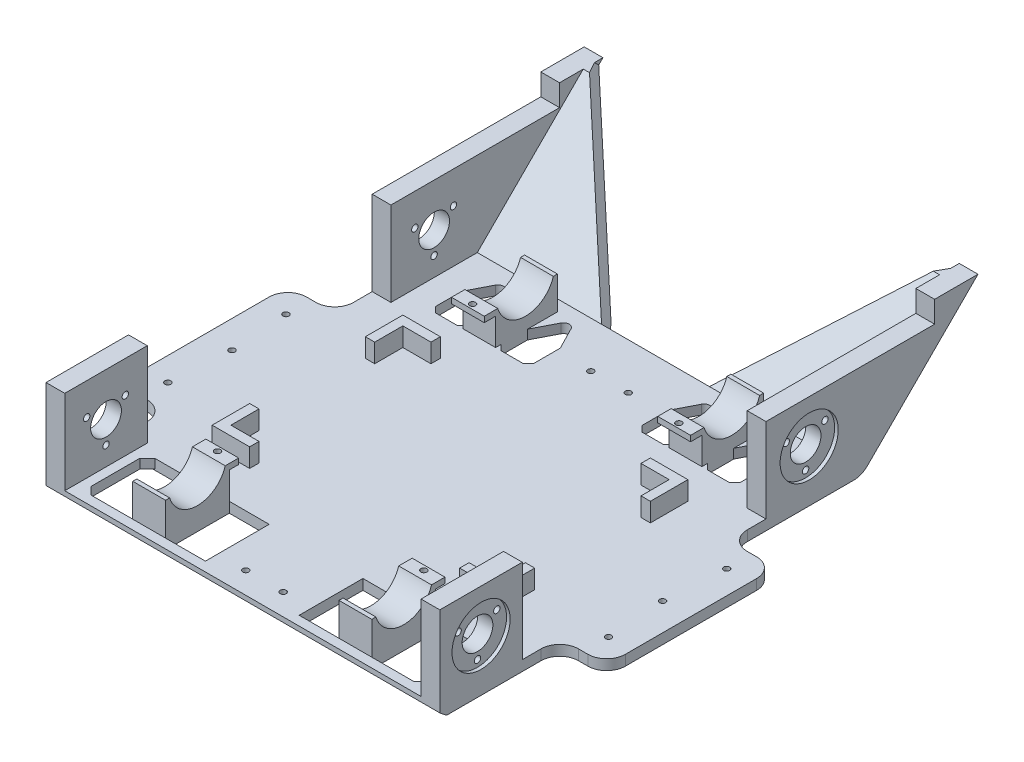
from build123d import *
from build123d.topology import SkipClean

# Parameters (mm, degrees)
SKETCH_1_W               = 5
SKETCH_1_H               = 10
EXTRUDE_1_DEPTH          = 5.5
SKETCH_3_W               = 5
SKETCH_3_H               = 46.066203836
SKETCH_3_H_2             = 44
EXTRUDE_2_DEPTH          = 44
CUT_EXTRUDE_1_DEPTH      = 316.357337
CUT_EXTRUDE_1_DEPTH_BACK = 316.357337
SKETCH_4_R               = 8.2
SKETCH_4_R_2             = 1.7
SKETCH_5_R               = 15.5
CUT_EXTRUDE_3_DEPTH      = 1.9
CUT_EXTRUDE_START        = -1.9
SKETCH_6_R               = 15.5
CUT_EXTRUDE_4_DEPTH      = 1.9
CUT_EXTRUDE_5_DEPTH      = 316.357337
CUT_EXTRUDE_5_DEPTH_BACK = 316.357337
SKETCH_7_R               = 8.2
SKETCH_7_R_2             = 1.7
SKETCH_8_R               = 15.5
CUT_EXTRUDE_6_DEPTH      = 1.9
SKETCH_9_R               = 15.5
CUT_EXTRUDE_7_DEPTH      = 1.9
SKETCH_10_W              = 10
SKETCH_10_H              = 34
EXTRUDE_3_DEPTH          = 5
SKETCH_11_W              = 5
SKETCH_11_H              = 41.066203836
SKETCH_11_H_2            = 5
SKETCH_11_H_3            = 44
EXTRUDE_4_DEPTH          = 44
CUT_EXTRUDE_8_DEPTH      = 315.095304008
CUT_EXTRUDE_8_DEPTH_BACK = 315.095304008
SKETCH_12_R              = 1.7
SKETCH_12_R_2            = 8.2
SKETCH_17_W              = 210
SKETCH_17_H              = 49.493882771
EXTRUDE_5_DEPTH          = 7.424621
EXTRUDE_11_DEPTH         = 5
EXTRUDE_13_DEPTH         = 210
FILLET_1_R               = 10
EXTRUDE_14_DEPTH         = 5
SKETCH_26_W              = 25
SKETCH_26_H              = 90
EXTRUDE_15_DEPTH         = 5.5
FILLET_2_R               = 10
CHAMFER_1_SIZE           = 4
CHAMFER_2_SIZE           = 3
FILLET_3_R               = 3
EXTRUDE_16_DEPTH         = 10
SKETCH_36_R              = 1.6
CUT_EXTRUDE_11_DEPTH     = 332.754427403
EXTRUDE_START            = -10
EXTRUDE_17_DEPTH         = 10
EXTRUDE_18_DEPTH         = 10
SKETCH_20_W              = 40
SKETCH_20_H              = 48.239190952
CUT_EXTRUDE_12_DEPTH     = 329.1701161
EXTRUDE_19_DEPTH         = 10
EXTRUDE_20_DEPTH         = 10
EXTRUDE_22_DEPTH         = 7.424621
CUT_EXTRUDE_13_DEPTH     = 190
EXTRUDE_23_DEPTH         = 210
CUT_EXTRUDE_14_DEPTH     = 331.617036792
SKETCH_45_W              = 190
SKETCH_45_H              = 7.424621202
CUT_EXTRUDE_16_DEPTH     = 27
EXTRUDE_25_DEPTH         = 5.5
CUT_EXTRUDE_START_2      = -210
CUT_EXTRUDE_20_DEPTH     = 210
FILLET_START             = -1
FILLET_4_DEPTH           = 212
SKETCH_54_W              = 17.5
SKETCH_54_H              = 34
EXTRUDE_26_DEPTH         = 17.5
SKETCH_55_W              = 17.5
SKETCH_55_H              = 34
EXTRUDE_27_DEPTH         = 5.5
CUT_EXTRUDE_START_3      = -17.5
SKETCH_56_R              = 15.5
CUT_EXTRUDE_22_DEPTH     = 127.5
SKETCH_57_W              = 5
SKETCH_57_H              = 3
EXTRUDE_28_DEPTH         = 17.5
EXTRUDE_START_2          = -17.5
SKETCH_60_W              = 5
SKETCH_60_H              = 3
EXTRUDE_29_DEPTH         = 17.5
SKETCH_62_R              = 1.6
CUT_EXTRUDE_24_DEPTH     = 3
EXTRUDE_30_DEPTH         = 17.5
EXTRUDE_31_DEPTH         = 17.5
SKETCH_66_W              = 1.033101918
SKETCH_66_H              = 3
EXTRUDE_32_DEPTH         = 17.5
EXTRUDE_33_DEPTH         = 17.5
SKETCH_68_R              = 1.6
CUT_EXTRUDE_25_DEPTH     = 3
SKETCH_69_R              = 1.6
CUT_EXTRUDE_26_DEPTH     = 333.513953992
SKETCH_70_W              = 43
SKETCH_70_H              = 15.5
CUT_EXTRUDE_27_DEPTH     = 210
CUT_EXTRUDE_28_DEPTH     = 210
SKETCH_74_W              = 210
SKETCH_74_H              = 2.596747752
CUT_EXTRUDE_30_DEPTH     = 10
SKETCH_75_W              = 10
SKETCH_75_H              = 44
SKETCH_75_H_2            = 89.924068212
EXTRUDE_34_DEPTH         = 1


with BuildPart() as part:
    # 草图1 → 凸台-拉伸1 (new body)
    with BuildSketch(Plane(origin=(0, 0, 0), x_dir=(1, 0, 0), z_dir=(0, 1, 0))):
        Polygon((85, -44), (5, -44), (5, -186), (85, -186), (85, -220), (125, -220), (125, -186), (205, -186), (205, -44), (125, -44), (125, -10), (85, -10), align=None)
        Polygon((3, 0), (0, 0), (0, -10), (5, -10), (5, 0), align=None)
        Polygon((5, -10), (0, -10), (0, -220), (5, -220), (5, -186), (5, -44), align=None)
        Polygon((205, 0), (5, 0), (5, -10), (85, -10), (125, -10), (205, -10), align=None)
        Polygon((210, -10), (205, -10), (205, -44), (205, -186), (205, -220), (210, -220), align=None)
        with Locations((207.5, -5)):
            Rectangle(SKETCH_1_W, SKETCH_1_H)
        Polygon((85, -220), (5, -220), (5, -230), (205, -230), (205, -220), (125, -220), align=None)
        with Locations((2.5, -225)):
            Rectangle(SKETCH_1_W, SKETCH_1_H)
        with Locations((207.5, -225)):
            Rectangle(SKETCH_1_W, SKETCH_1_H)
    extrude(amount=EXTRUDE_1_DEPTH)

    # 草图3 → 凸台-拉伸2 (add)
    with BuildSketch(Plane(origin=(0, 5.5, 0), x_dir=(1, 0, 0), z_dir=(0, 1, 0))):
        with Locations((2.5, -28.033101918)):
            Rectangle(SKETCH_3_W, SKETCH_3_H)
        with Locations((2.5, -203)):
            Rectangle(SKETCH_3_W, SKETCH_3_H_2)
        with Locations((207.5, -203)):
            Rectangle(SKETCH_3_W, SKETCH_3_H_2)
        with Locations((207.5, -28.033101918)):
            Rectangle(SKETCH_3_W, SKETCH_3_H)
    extrude(amount=EXTRUDE_2_DEPTH)

    # 草图4 → 切除-拉伸1 (cut, two sides: drawn at the far end of the back side and taken through both)
    with BuildSketch(Plane.ZY.offset(-CUT_EXTRUDE_1_DEPTH_BACK)):
        with Locations((28.033101918, 27.5)):
            Circle(SKETCH_4_R)
        with Locations((28.033101918, 15.6)):
            Circle(SKETCH_4_R_2)
        with Locations((17.727399613, 33.45)):
            Circle(SKETCH_4_R_2)
        with Locations((38.338804223, 33.45)):
            Circle(SKETCH_4_R_2)
    extrude(amount=CUT_EXTRUDE_1_DEPTH + CUT_EXTRUDE_1_DEPTH_BACK, mode=Mode.SUBTRACT)

    # 草图5 → 切除-拉伸3 (cut)
    with BuildSketch(Plane.ZY):
        with Locations((28.033101918, 27.5)):
            Circle(SKETCH_5_R)
    extrude(amount=-CUT_EXTRUDE_3_DEPTH, mode=Mode.SUBTRACT)

    # 草图6 → 切除-拉伸4 (cut)
    with BuildSketch(Plane(origin=(210, 0, 0), x_dir=(0, 0, -1), z_dir=(1, 0, 0)).offset(CUT_EXTRUDE_START)):
        with Locations(Location((-28.033101918, 27.5, 0), (0, 0, 180))):
            Circle(SKETCH_6_R)
    extrude(amount=CUT_EXTRUDE_4_DEPTH, mode=Mode.SUBTRACT)

    # 草图7 → 切除-拉伸5 (cut, two sides: drawn at the far end of the back side and taken through both)
    with BuildSketch(Plane.ZY.offset(-CUT_EXTRUDE_5_DEPTH_BACK)):
        with Locations((203, 27.5)):
            Circle(SKETCH_7_R)
        with Locations((203, 15.6)):
            Circle(SKETCH_7_R_2)
        with Locations((192.694297695, 33.45)):
            Circle(SKETCH_7_R_2)
        with Locations((213.305702305, 33.45)):
            Circle(SKETCH_7_R_2)
    extrude(amount=CUT_EXTRUDE_5_DEPTH + CUT_EXTRUDE_5_DEPTH_BACK, mode=Mode.SUBTRACT)

    # 草图8 → 切除-拉伸6 (cut)
    with BuildSketch(Plane.ZY):
        with Locations((203, 27.5)):
            Circle(SKETCH_8_R)
    extrude(amount=-CUT_EXTRUDE_6_DEPTH, mode=Mode.SUBTRACT)

    # 草图9 → 切除-拉伸7 (cut)
    with BuildSketch(Plane(origin=(210, 0, 0), x_dir=(0, 0, -1), z_dir=(1, 0, 0)).offset(CUT_EXTRUDE_START)):
        with Locations(Location((-203, 27.5, 0), (0, 0, 180))):
            Circle(SKETCH_9_R)
    extrude(amount=CUT_EXTRUDE_7_DEPTH, mode=Mode.SUBTRACT)

    # 草图10 → 凸台-拉伸3 (add)
    with BuildSketch(Plane(origin=(0, 5.5, 0), x_dir=(1, 0, 0), z_dir=(0, 1, 0))):
        with Locations((200, -27)):
            Rectangle(SKETCH_10_W, SKETCH_10_H)
        with Locations((10, -27)):
            Rectangle(SKETCH_10_W, SKETCH_10_H)
        with Locations((10, -203)):
            Rectangle(SKETCH_10_W, SKETCH_10_H)
        with Locations((200, -203)):
            Rectangle(SKETCH_10_W, SKETCH_10_H)
    extrude(amount=-EXTRUDE_3_DEPTH)

    # 草图11 → 凸台-拉伸4 (add)
    with BuildSketch(Plane(origin=(0, 5.5, 0), x_dir=(1, 0, 0), z_dir=(0, 1, 0))):
        with Locations((7.5, -30.533101918)):
            Rectangle(SKETCH_11_W, SKETCH_11_H)
        with Locations((7.5, -7.5)):
            Rectangle(SKETCH_11_W, SKETCH_11_H_2)
        with Locations((202.5, -7.5)):
            Rectangle(SKETCH_11_W, SKETCH_11_H_2)
        with Locations((202.5, -30.533101918)):
            Rectangle(SKETCH_11_W, SKETCH_11_H)
        with Locations((7.5, -203)):
            Rectangle(SKETCH_11_W, SKETCH_11_H_3)
        with Locations((202.5, -203)):
            Rectangle(SKETCH_11_W, SKETCH_11_H_3)
    extrude(amount=EXTRUDE_4_DEPTH)

    # 草图12 → 切除-拉伸8 (cut, two sides: drawn at the far end of the back side and taken through both)
    with BuildSketch(Plane.ZY.offset(-1.9).offset(-CUT_EXTRUDE_8_DEPTH_BACK)):
        with Locations(Location((17.727399613, 33.45, 0), (0, 0, 180))):
            Circle(SKETCH_12_R)
        with Locations(Location((38.338804223, 33.45, 0), (0, 0, 180))):
            Circle(SKETCH_12_R)
        with Locations(Location((28.033101918, 15.6, 0), (0, 0, 180))):
            Circle(SKETCH_12_R)
        with Locations(Location((28.033101918, 27.5, 0), (0, 0, 180))):
            Circle(SKETCH_12_R_2)
        with Locations(Location((192.694297695, 33.45, 0), (0, 0, 180))):
            Circle(SKETCH_12_R)
        with Locations(Location((213.305702305, 33.45, 0), (0, 0, 180))):
            Circle(SKETCH_12_R)
        with Locations(Location((203, 15.6, 0), (0, 0, 180))):
            Circle(SKETCH_12_R)
        with Locations(Location((203, 27.5, 0), (0, 0, 180))):
            Circle(SKETCH_12_R_2)
    extrude(amount=CUT_EXTRUDE_8_DEPTH + CUT_EXTRUDE_8_DEPTH_BACK, mode=Mode.SUBTRACT)

    # 草图17 → 凸台-拉伸5 (add, through all)
    with BuildSketch(Plane(origin=(0, 5.25, 5.25), x_dir=(1, 0, 0), z_dir=(0, 0.7071067811865464, 0.7071067811865487))):
        with Locations((105, 25.100494776)):
            Rectangle(SKETCH_17_W, SKETCH_17_H)
    extrude(amount=-EXTRUDE_5_DEPTH)

    # 草图21 → 凸台-拉伸11 (add)
    with BuildSketch(Plane(origin=(0, 5.5, 0), x_dir=(1, 0, 0), z_dir=(0, 1, 0))):
        Polygon((15, -44), (32.5, -10), (15, -10), align=None)
        Polygon((67.5, -10), (32.5, -10), (41.25, -27), (50, -44), (58.75, -27), align=None)
        Polygon((50, -44), (41.25, -27), (41.25, -44), align=None)
        Polygon((58.75, -27), (50, -44), (58.75, -44), align=None)
        Polygon((85, -10), (67.5, -10), (85, -44), align=None)
        Polygon((125, -10), (125, -44), (142.5, -10), align=None)
        Polygon((177.5, -10), (142.5, -10), (151.25, -27), (160, -44), (168.75, -27), align=None)
        Polygon((195, -10), (177.5, -10), (195, -44), align=None)
        Polygon((168.75, -27), (160, -44), (168.75, -44), align=None)
        Polygon((151.25, -27), (151.25, -44), (160, -44), align=None)
    extrude(amount=-EXTRUDE_11_DEPTH)

    # 草图22 → 凸台-拉伸13 (add)
    with SkipClean():  # the faces are left unmerged after this step: merging them gives an invalid solid
        with BuildSketch(Plane.ZY):
            Polygon((0, 0.5), (0, 0), (-0.25, 0.25), align=None)
        extrude(amount=-EXTRUDE_13_DEPTH)

    # 圆角1
    fillet_1_edges = [part.edges().sort_by_distance(p)[0] for p in [
        (105, 0, 0),
    ]]
    fillet(fillet_1_edges, radius=FILLET_1_R)

    # 草图23 → 凸台-拉伸14 (add)
    with BuildSketch(Plane(origin=(0, 5.5, 0), x_dir=(1, 0, 0), z_dir=(0, 1, 0))):
        Polygon((23.75, -27), (23.75, -44), (15, -44), align=None)
        Polygon((76.25, -27), (76.25, -44), (85, -44), align=None)
        Polygon((133.75, -27), (133.75, -44), (125, -44), align=None)
        Polygon((186.25, -27), (186.25, -44), (195, -44), align=None)
    extrude(amount=-EXTRUDE_14_DEPTH)

    # 草图26 → 凸台-拉伸15 (add)
    with BuildSketch(Plane(origin=(0, 5.5, 0), x_dir=(1, 0, 0), z_dir=(0, 1, 0))):
        with Locations((-12.5, -116.033101918)):
            Rectangle(SKETCH_26_W, SKETCH_26_H)
        with Locations((222.5, -116.033101918)):
            Rectangle(SKETCH_26_W, SKETCH_26_H)
    extrude(amount=-EXTRUDE_15_DEPTH)

    # 圆角2
    fillet_2_edges = [part.edges().sort_by_distance(p)[0] for p in [
        (0, 2.75, 161.033101918),
        (-25, 2.75, 161.033101918),
        (-25, 2.75, 71.033101918),
        (0, 2.75, 71.033101918),
        (235, 2.75, 161.033101918),
        (210, 2.75, 161.033101918),
        (210, 2.75, 71.033101918),
        (235, 2.75, 71.033101918),
    ]]
    fillet(fillet_2_edges, radius=FILLET_2_R)

    # 倒角1
    chamfer_1_edges = [part.edges().sort_by_distance(p)[0] for p in [
        (15, 3, 186),
        (15, 3, 220),
        (195, 3, 220),
        (195, 3, 186),
        (85, 2.75, 220),
        (85, 2.75, 186),
        (125, 2.75, 186),
        (125, 2.75, 220),
    ]]
    chamfer(chamfer_1_edges, length=CHAMFER_1_SIZE)

    # 倒角2
    chamfer_2_edges = [part.edges().sort_by_distance(p)[0] for p in [
        (58.75, 3, 44),
        (41.25, 3, 44),
        (168.75, 3, 44),
        (151.25, 3, 44),
        (23.75, 3, 44),
        (76.25, 3, 44),
        (133.75, 3, 44),
        (186.25, 3, 44),
    ]]
    chamfer(chamfer_2_edges, length=CHAMFER_2_SIZE)

    # 圆角3
    fillet_3_edges = [part.edges().sort_by_distance(p)[0] for p in [
        (32.5, 3, 10),
        (67.5, 3, 10),
        (142.5, 3, 10),
        (177.5, 3, 10),
    ]]
    fillet(fillet_3_edges, radius=FILLET_3_R)

    # 草图28 → 凸台-拉伸16 (add)
    with BuildSketch(Plane(origin=(0, 5.5, 0), x_dir=(1, 0, 0), z_dir=(0, 1, 0))):
        Polygon((34, -83.707540062), (34, -68.707540058), (49, -68.707540058), (49, -63.707540062), (29, -63.707540062), (29, -83.707540062), align=None)
        Polygon((161, -63.707540062), (161, -68.707540058), (176, -68.707540058), (176, -83.707540062), (181, -83.707540062), (181, -63.707540062), align=None)
        Polygon((176, -160.407540058), (161, -160.407540058), (161, -165.407540062), (181, -165.407540062), (181, -145.407540062), (176, -145.407540062), align=None)
        Polygon((34, -160.407540058), (34, -145.407540062), (29, -145.407540062), (29, -165.407540062), (49, -165.407540062), (49, -160.407540058), align=None)
    extrude(amount=EXTRUDE_16_DEPTH)

    # 草图36 → 切除-拉伸11 (cut, through all)
    with BuildSketch(Plane(origin=(0, 5.5, 0), x_dir=(1, 0, 0), z_dir=(0, 1, 0))):
        with Locations(Location((115, -213.5, 0), (0, 0, 270))):
            Circle(SKETCH_36_R)
        with Locations(Location((222.5, -147.533101918, 0), (0, 0, 270))):
            Circle(SKETCH_36_R)
        with Locations(Location((222.5, -84.533101918, 0), (0, 0, 270))):
            Circle(SKETCH_36_R)
        with Locations(Location((115, -29.5, 0), (0, 0, 270))):
            Circle(SKETCH_36_R)
        with Locations(Location((95, -29.5, 0), (0, 0, 90))):
            Circle(SKETCH_36_R)
        with Locations(Location((-12.5, -84.533101918, 0), (0, 0, 90))):
            Circle(SKETCH_36_R)
        with Locations(Location((-12.5, -147.533101918, 0), (0, 0, 90))):
            Circle(SKETCH_36_R)
        with Locations(Location((95, -213.5, 0), (0, 0, 90))):
            Circle(SKETCH_36_R)
    extrude(amount=-CUT_EXTRUDE_11_DEPTH, mode=Mode.SUBTRACT)

    # 草图18 → 凸台-拉伸17 (add)
    with BuildSketch(Plane.ZY.offset(EXTRUDE_START)):
        Polygon((-35.247460135, 35.247460135), (-29.997460135, 40.497460135), (-39, 49.5), (-44.25, 44.25), align=None)
        Polygon((-29.997460135, 40.497460135), (5, 5.5), (5, 49.5), (-39, 49.5), align=None)
    extrude(amount=EXTRUDE_17_DEPTH)

    # 草图37 → 凸台-拉伸18 (add)
    with BuildSketch(Plane(origin=(210, 0, 0), x_dir=(0, 0, -1), z_dir=(1, 0, 0)).offset(EXTRUDE_START)):
        Polygon((-5, 49.5), (-5, 5.5), (29.997460135, 40.497460135), (35.247460135, 35.247460135), (44.25, 44.25), (39, 49.5), align=None)
    extrude(amount=EXTRUDE_18_DEPTH)

    # 草图20 → 切除-拉伸12 (cut, through all)
    with BuildSketch(Plane(origin=(0, 5.25, 5.25), x_dir=(1, 0, 0), z_dir=(0, 0.7071067811865465, 0.7071067811865487))):
        Polygon((85, 49.847436162), (15, 49.847436162), (85, 1.60824521), align=None)
        with Locations((105, 25.727840686)):
            Rectangle(SKETCH_20_W, SKETCH_20_H)
        Polygon((125, 49.847436162), (125, 1.60824521), (195, 49.847436162), align=None)
    extrude(amount=-CUT_EXTRUDE_12_DEPTH, mode=Mode.SUBTRACT)

    # 草图38 → 凸台-拉伸19 (add)
    with BuildSketch(Plane.ZY.offset(EXTRUDE_START)):
        Polygon((4.142135624, 65), (4.142135624, 49.5), (-39, 49.5), (-44.25, 44.25), (-65, 65), (-38.958410494, 65), align=None)
    extrude(amount=EXTRUDE_19_DEPTH)

    # 草图39 → 凸台-拉伸20 (add)
    with BuildSketch(Plane(origin=(210, 0, 0), x_dir=(0, 0, -1), z_dir=(1, 0, 0)).offset(EXTRUDE_START)):
        Polygon((-4.142135624, 49.5), (-4.142135624, 65), (65, 65), (44.25, 44.25), (39, 49.5), align=None)
    extrude(amount=EXTRUDE_20_DEPTH)

    # 草图40 → 凸台-拉伸22 (add)
    with BuildSketch(Plane(origin=(0, 5.25, 5.25), x_dir=(1, 0, 0), z_dir=(0, 0.7071067811865464, 0.7071067811865487))):
        Polygon((10, 49.847436162), (10, 91.923881554), (200, 91.923881554), (200, 49.847436162), (195, 49.847436162), (125, 1.60824521), (85, 1.60824521), (15, 49.847436162), align=None)
    extrude(amount=-EXTRUDE_22_DEPTH)

    # 草图41 → 切除-拉伸13 (cut)
    with BuildSketch(Plane.ZY.offset(-10)):
        Polygon((-59.75, 70.25), (-65, 65), (-54.5, 65), align=None)
    extrude(amount=-CUT_EXTRUDE_13_DEPTH, mode=Mode.SUBTRACT)

    # 草图42 → 凸台-拉伸23 (add)
    with BuildSketch(Plane(origin=(210, 0, 0), x_dir=(0, 0, -1), z_dir=(1, 0, 0))):
        Polygon((-4.142135624, 0), (0, 0), (2.033066641, 2.033066641), (2.928932188, 2.928932188), align=None)
    extrude(amount=-EXTRUDE_23_DEPTH)

    # 草图43 → 切除-拉伸14 (cut, through all)
    with BuildSketch(Plane(origin=(0, 5.25, 5.25), x_dir=(1, 0, 0), z_dir=(0, 0.7071067811865465, 0.7071067811865487))):
        Polygon((10, 84.499260352), (76.25, 0.353553391), (105, 0.353553391), (105, 84.499260352), align=None)
        Polygon((105, 84.499260352), (105, 0.353553391), (133.75, 0.353553391), (200, 84.499260352), align=None)
    extrude(amount=-CUT_EXTRUDE_14_DEPTH, mode=Mode.SUBTRACT)

    # 草图45 → 切除-拉伸16 (cut)
    with BuildSketch(Plane(origin=(0, 0, 0), x_dir=(1, 0, 0), z_dir=(0, -0.7071067811865465, -0.7071067811865487))):
        with Locations((105, -88.211570953)):
            Rectangle(SKETCH_45_W, SKETCH_45_H)
    extrude(amount=-CUT_EXTRUDE_16_DEPTH, mode=Mode.SUBTRACT)

    # 草图49 → 凸台-拉伸25 (add)
    with BuildSketch(Plane(origin=(0, 5.5, 0), x_dir=(1, 0, 0), z_dir=(0, 1, 0))):
        Polygon((80, -186), (80, -220), (81, -220), (85, -216), (85, -190), (81, -186), align=None)
        Polygon((130, -186), (130, -220), (129, -220), (125, -216), (125, -190), (129, -186), align=None)
    extrude(amount=-EXTRUDE_25_DEPTH)

    # 草图52 → 切除-拉伸20 (cut)
    with BuildSketch(Plane.ZY.offset(CUT_EXTRUDE_START_2)):
        with BuildLine():
            Line((227.596747752, 5.5), (230, 5.5))
            Line((230, 5.5), (230, 0))
            Line((230, 0), (221.241436347, 0))
            ThreePointArc((221.241436347, 0), (224.594906905, 2.546843972), (227.596747752, 5.5))
        make_face()
    extrude(amount=CUT_EXTRUDE_20_DEPTH, mode=Mode.SUBTRACT)

    # 圆角4: read off the stored shape, not the designer's step
    # 圆角4 outline → 圆角4 (cut)
    with BuildSketch(Plane.YZ.offset(FILLET_START)):
        with BuildLine():
            Line((0, 4.142135624), (0, 0))
            Line((0, 0), (2.928932188, -2.928932188))
            ThreePointArc((2.928932188, -2.928932188), (0.761204675, 0.3153013), (0, 4.142135624))
        make_face()
    extrude(amount=FILLET_4_DEPTH, mode=Mode.SUBTRACT)

    # 草图54 → 凸台-拉伸26 (add)
    with BuildSketch(Plane(origin=(0, 5.5, 0), x_dir=(1, 0, 0), z_dir=(0, 1, 0))):
        Polygon((58.75, -27), (58.75, -41), (58.75, -44), (41.25, -44), (41.25, -41), (41.25, -27), (41.25, -13.555321876), (58.75, -13.555321876), align=None)
        with Locations((50, -203)):
            Rectangle(SKETCH_54_W, SKETCH_54_H)
        with Locations((160, -203)):
            Rectangle(SKETCH_54_W, SKETCH_54_H)
        Polygon((151.25, -27), (151.25, -41), (151.25, -44), (168.75, -44), (168.75, -41), (168.75, -27), (168.75, -13.555321876), (151.25, -13.555321876), align=None)
    extrude(amount=EXTRUDE_26_DEPTH)


with BuildPart() as extrude_26_piece_1:
    # of the separate pieces the step leaves, piece 1, a body of its own (extrude_26_pieces)
    add(part.part.solids().sort_by_distance((210, 5.5, 171.033101918))[0])



with BuildPart() as extrude_26_piece_2:
    # of the separate pieces the step leaves, piece 2, a body of its own (extrude_26_pieces)
    add(part.part.solids().sort_by_distance((41.25, 23, 186))[0])


with BuildPart() as extrude_26_piece_3:
    # of the separate pieces the step leaves, piece 3, a body of its own (extrude_26_pieces)
    add(part.part.solids().sort_by_distance((168.75, 23, 186))[0])


with BuildPart() as extrude_26_piece_1_1:
    add(extrude_26_piece_1.part)

    add(extrude_26_piece_2.part)  # 凸台-拉伸27 merges 凸台-拉伸26 piece 2

    add(extrude_26_piece_3.part)  # 凸台-拉伸27 merges 凸台-拉伸26 piece 3
    # 草图55 → 凸台-拉伸27 (add)
    with BuildSketch(Plane.XZ.offset(-5.5)):
        with Locations((50, 203)):
            Rectangle(SKETCH_55_W, SKETCH_55_H)
        with Locations((160, 203)):
            Rectangle(SKETCH_55_W, SKETCH_55_H)
    extrude(amount=EXTRUDE_27_DEPTH)

    # 草图56 → 切除-拉伸22 (cut)
    with BuildSketch(Plane(origin=(58.75, 0, 0), x_dir=(0, 0, -1), z_dir=(1, 0, 0)).offset(CUT_EXTRUDE_START_3)):
        with Locations(Location((-203, 27.5, 0), (0, 0, 180))):
            Circle(SKETCH_56_R)
        with Locations(Location((-28.033101918, 27.5, 0), (0, 0, 180))):
            Circle(SKETCH_56_R)
    extrude(amount=CUT_EXTRUDE_22_DEPTH, mode=Mode.SUBTRACT)

    # 草图57 → 凸台-拉伸28 (add)
    with BuildSketch(Plane(origin=(58.75, 0, 0), x_dir=(0, 0, -1), z_dir=(1, 0, 0))):
        with Locations((-183.5, 21.5)):
            Rectangle(SKETCH_57_W, SKETCH_57_H)
        with Locations((-46.5, 21.5)):
            Rectangle(SKETCH_57_W, SKETCH_57_H)
    extrude(amount=-EXTRUDE_28_DEPTH)

    # 草图60 → 凸台-拉伸29 (add)
    with BuildSketch(Plane(origin=(168.75, 0, 0), x_dir=(0, 0, -1), z_dir=(1, 0, 0)).offset(EXTRUDE_START_2)):
        with Locations((-183.5, 21.5)):
            Rectangle(SKETCH_60_W, SKETCH_60_H)
        with Locations((-46.5, 21.5)):
            Rectangle(SKETCH_60_W, SKETCH_60_H)
    extrude(amount=EXTRUDE_29_DEPTH)

    # 草图62 → 切除-拉伸24 (cut)
    with BuildSketch(Plane(origin=(0, 23, 0), x_dir=(1, 0, 0), z_dir=(0, 1, 0))):
        with Locations(Location((50, -183.5, 0), (0, 0, 270))):
            Circle(SKETCH_62_R)
        with Locations(Location((160, -183.5, 0), (0, 0, 90))):
            Circle(SKETCH_62_R)
    extrude(amount=-CUT_EXTRUDE_24_DEPTH, mode=Mode.SUBTRACT)

    # 草图64 → 凸台-拉伸30 (add)
    with BuildSketch(Plane.ZY.offset(-41.25).offset(EXTRUDE_START_2)):
        with BuildLine():
            Line((11.033101918, 23), (11.033101918, 5.5))
            Line((11.033101918, 5.5), (13.555321876, 5.5))
            Line((13.555321876, 5.5), (13.555321876, 21.964308078))
            ThreePointArc((13.555321876, 21.964308078), (13.368867072, 22.479022368), (13.200704944, 23))
            Line((13.200704944, 23), (11.033101918, 23))
        make_face()
    extrude(amount=EXTRUDE_30_DEPTH)

    # 草图65 → 凸台-拉伸31 (add)
    with BuildSketch(Plane(origin=(168.75, 0, 0), x_dir=(0, 0, -1), z_dir=(1, 0, 0)).offset(EXTRUDE_START_2)):
        with BuildLine():
            Line((-13.200704944, 23), (-11.033101918, 23))
            Line((-11.033101918, 23), (-11.033101918, 5.5))
            Line((-11.033101918, 5.5), (-13.555321876, 5.5))
            Line((-13.555321876, 5.5), (-13.555321876, 21.964308078))
            ThreePointArc((-13.555321876, 21.964308078), (-13.368867072, 22.479022368), (-13.200704944, 23))
        make_face()
    extrude(amount=EXTRUDE_31_DEPTH)

    # 草图66 → 凸台-拉伸32 (add)
    with BuildSketch(Plane(origin=(168.75, 0, 0), x_dir=(0, 0, -1), z_dir=(1, 0, 0)).offset(EXTRUDE_START_2)):
        with Locations((-49.516550959, 21.5)):
            Rectangle(SKETCH_66_W, SKETCH_66_H)
    extrude(amount=EXTRUDE_32_DEPTH)

    # 草图67 → 凸台-拉伸33 (add)
    with BuildSketch(Plane(origin=(58.75, 0, 0), x_dir=(0, 0, -1), z_dir=(1, 0, 0)).offset(EXTRUDE_START_2)):
        Polygon((-48.984416212, 23), (-50.033101918, 23), (-50.033101918, 20), (-49, 20), align=None)
    extrude(amount=EXTRUDE_33_DEPTH)

    # 草图68 → 切除-拉伸25 (cut)
    with BuildSketch(Plane(origin=(0, 23, 0), x_dir=(1, 0, 0), z_dir=(0, 1, 0))):
        with Locations(Location((50, -47.533101918, 0), (0, 0, 270))):
            Circle(SKETCH_68_R)
        with Locations(Location((160, -47.533101918, 0), (0, 0, 90))):
            Circle(SKETCH_68_R)
    extrude(amount=-CUT_EXTRUDE_25_DEPTH, mode=Mode.SUBTRACT)

    # 草图69 → 切除-拉伸26 (cut, through all)
    with BuildSketch(Plane(origin=(0, 5.5, 0), x_dir=(1, 0, 0), z_dir=(0, 1, 0))):
        with Locations(Location((222.5, -84.533101918, 0), (0, 0, 270))):
            Circle(SKETCH_69_R)
        with Locations(Location((222.5, -147.533101918, 0), (0, 0, 270))):
            Circle(SKETCH_69_R)
        with Locations(Location((220.323268139, -116.533101918, 0), (0, 0, 270))):
            Circle(SKETCH_69_R)
        with Locations(Location((-12.5, -84.533101918, 0), (0, 0, 90))):
            Circle(SKETCH_69_R)
        with Locations(Location((-10.323268139, -115.533101918, 0), (0, 0, 270))):
            Circle(SKETCH_69_R)
        with Locations(Location((-12.5, -147.533101918, 0), (0, 0, 90))):
            Circle(SKETCH_69_R)
        with Locations(Location((95, -29.5, 0), (0, 0, 90))):
            Circle(SKETCH_69_R)
        with Locations(Location((115, -29.5, 0), (0, 0, 270))):
            Circle(SKETCH_69_R)
        with Locations(Location((95, -213.5, 0), (0, 0, 90))):
            Circle(SKETCH_69_R)
        with Locations(Location((115, -213.5, 0), (0, 0, 270))):
            Circle(SKETCH_69_R)
    extrude(amount=-CUT_EXTRUDE_26_DEPTH, mode=Mode.SUBTRACT)

    # 草图70 → 切除-拉伸27 (cut)
    with BuildSketch(Plane.ZY.offset(CUT_EXTRUDE_START_2)):
        with Locations((-17.357864376, 57.25)):
            Rectangle(SKETCH_70_W, SKETCH_70_H)
    extrude(amount=CUT_EXTRUDE_27_DEPTH, mode=Mode.SUBTRACT)

    # 草图71 → 切除-拉伸28 (cut)
    with BuildSketch(Plane.ZY.offset(CUT_EXTRUDE_START_2)):
        Polygon((-57.454223921, 62), (-62, 62), (-65, 65), (-38.857864376, 65), (-38.857864376, 62), align=None)
    extrude(amount=CUT_EXTRUDE_28_DEPTH, mode=Mode.SUBTRACT)

    # 草图74 → 切除-拉伸30 (cut)
    with BuildSketch(Plane(origin=(0, 5.5, 0), x_dir=(1, 0, 0), z_dir=(0, 1, 0))):
        with Locations((105, -226.298373876)):
            Rectangle(SKETCH_74_W, SKETCH_74_H)
    extrude(amount=-CUT_EXTRUDE_30_DEPTH, mode=Mode.SUBTRACT)

    # 草图75 → 凸台-拉伸34 (add)
    with BuildSketch(Plane(origin=(0, 49.5, 0), x_dir=(1, 0, 0), z_dir=(0, 1, 0))):
        with Locations((5, -203)):
            Rectangle(SKETCH_75_W, SKETCH_75_H)
        with Locations((205, -203)):
            Rectangle(SKETCH_75_W, SKETCH_75_H)
        with Locations((5, -6.10416973)):
            Rectangle(SKETCH_75_W, SKETCH_75_H_2)
        with Locations((205, -6.10416973)):
            Rectangle(SKETCH_75_W, SKETCH_75_H_2)
    extrude(amount=EXTRUDE_34_DEPTH)


solid = extrude_26_piece_1_1.part
